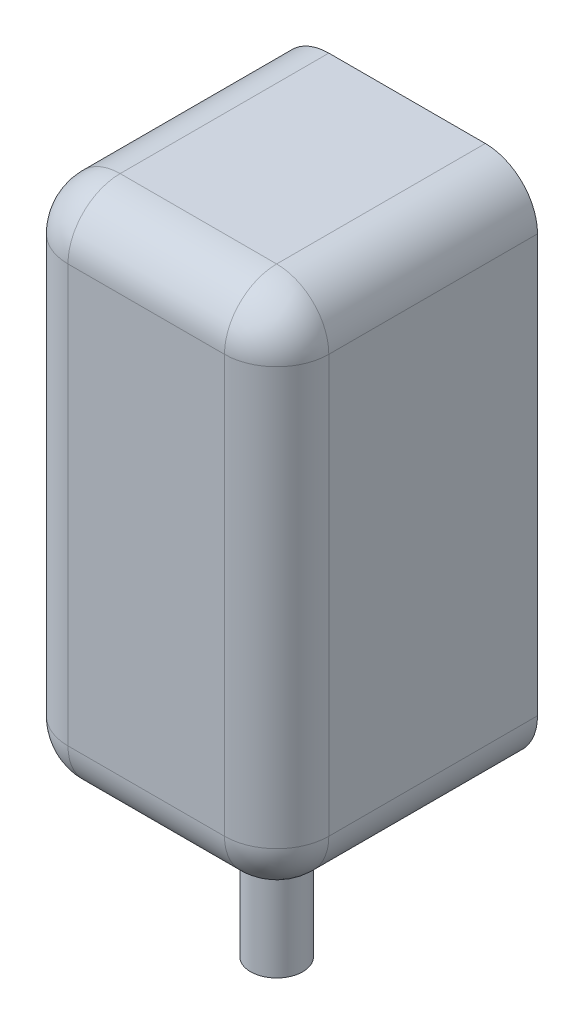
from build123d import *

# Parameters (mm, degrees)
SKETCH1_W           = 50
SKETCH1_H           = 50
BOSS_EXTRUDE1_DEPTH = 100
SKETCH2_R           = 5
BOSS_EXTRUDE2_DEPTH = 30
FILLET1_R           = 10
FILLET2_R           = 10


with BuildPart() as part:
    # Sketch1 → Boss-Extrude1 (new body)
    with BuildSketch(Plane(origin=(0, 0, 0), x_dir=(1, 0, 0), z_dir=(0, 1, 0))):
        Rectangle(SKETCH1_W, SKETCH1_H)
    extrude(amount=BOSS_EXTRUDE1_DEPTH)

    # Sketch2 → Boss-Extrude2 (add)
    with BuildSketch(Plane.XZ):
        with Locations(Location((0, 0, 0), (0, 0, 90))):
            Circle(SKETCH2_R)
    extrude(amount=BOSS_EXTRUDE2_DEPTH)

    # Fillet1
    fillet1_edges = [part.edges().sort_by_distance(p)[0] for p in [
        (0, 100, 25),
        (0, 0, 25),
        (25, 50, 25),
        (-25, 50, 25),
    ]]
    fillet(fillet1_edges, radius=FILLET1_R)

    # Fillet2
    # the kernel refuses this fillet: 10 mm, written as the material it takes off along each edge
    with BuildSketch(Plane(origin=(-15, 90, 15), x_dir=(0, 1, 0), z_dir=(-1, 0, 0))) as fillet2_piece_1_section:
        Polygon((0, 0), (FILLET2_R, 0), (FILLET2_R, -FILLET2_R), (0, -FILLET2_R), align=None)
    fillet2_piece_1 = extrude(amount=FILLET2_R, mode=Mode.PRIVATE)
    fillet2_piece_1 = fillet2_piece_1 - Plane(origin=(-15, 90, 15), x_dir=(0, -0.7071067811865475, -0.7071067811865475), z_dir=(-1, 0, 0)) * Sphere(FILLET2_R, mode=Mode.PRIVATE)
    add(fillet2_piece_1, mode=Mode.SUBTRACT)
    with BuildSketch(Plane(origin=(15, 90, 15), x_dir=(1, 0, 0), z_dir=(0, 1, 0))) as fillet2_piece_2_section:
        Polygon((0, 0), (FILLET2_R, 0), (FILLET2_R, -FILLET2_R), (0, -FILLET2_R), align=None)
    fillet2_piece_2 = extrude(amount=FILLET2_R, mode=Mode.PRIVATE)
    fillet2_piece_2 = fillet2_piece_2 - Plane(origin=(15, 90, 15), x_dir=(-0.7071067811865475, 0, -0.7071067811865475), z_dir=(0, 1, 0)) * Sphere(FILLET2_R, mode=Mode.PRIVATE)
    add(fillet2_piece_2, mode=Mode.SUBTRACT)
    with BuildSketch(Plane(origin=(-15, 10, 15), x_dir=(0, -1, 0), z_dir=(-1, 0, 0))) as fillet2_piece_3_section:
        Polygon((0, 0), (FILLET2_R, 0), (FILLET2_R, FILLET2_R), (0, FILLET2_R), align=None)
    fillet2_piece_3 = extrude(amount=FILLET2_R, mode=Mode.PRIVATE)
    fillet2_piece_3 = fillet2_piece_3 - Plane(origin=(-15, 10, 15), x_dir=(0, 0.7071067811865475, -0.7071067811865475), z_dir=(-1, 0, 0)) * Sphere(FILLET2_R, mode=Mode.PRIVATE)
    add(fillet2_piece_3, mode=Mode.SUBTRACT)
    with BuildSketch(Plane(origin=(15, 10, 15), x_dir=(1, 0, 0), z_dir=(0, -1, 0))) as fillet2_piece_4_section:
        Polygon((0, 0), (FILLET2_R, 0), (FILLET2_R, FILLET2_R), (0, FILLET2_R), align=None)
    fillet2_piece_4 = extrude(amount=FILLET2_R, mode=Mode.PRIVATE)
    fillet2_piece_4 = fillet2_piece_4 - Plane(origin=(15, 10, 15), x_dir=(-0.7071067811865475, 0, -0.7071067811865475), z_dir=(0, -1, 0)) * Sphere(FILLET2_R, mode=Mode.PRIVATE)
    add(fillet2_piece_4, mode=Mode.SUBTRACT)
    with BuildSketch(Plane(origin=(-25, 100, 15), x_dir=(0, -1, 0), z_dir=(0, 0, -1)), Plane(origin=(25, 0, -50), x_dir=(-1, 0, 0), z_dir=(0, 0, 1))) as fillet2_piece_5:
        with BuildLine():
            CenterArc((FILLET2_R, -FILLET2_R), FILLET2_R, 90, 90)
            Line((0, -FILLET2_R), (0, 0))
            Line((0, 0), (FILLET2_R, 0))
        make_face()
    extrude(amount=65, mode=Mode.SUBTRACT)
    with BuildSketch(Plane(origin=(25, 100, -50), x_dir=(-1, 0, 0), z_dir=(0, 0, 1)), Plane(origin=(-25, 0, 15), x_dir=(0, 1, 0), z_dir=(0, 0, -1))) as fillet2_piece_6:
        with BuildLine():
            CenterArc((FILLET2_R, FILLET2_R), FILLET2_R, 180, 90)
            Line((0, FILLET2_R), (0, 0))
            Line((0, 0), (FILLET2_R, 0))
        make_face()
    extrude(amount=65, mode=Mode.SUBTRACT)


solid = part.part
